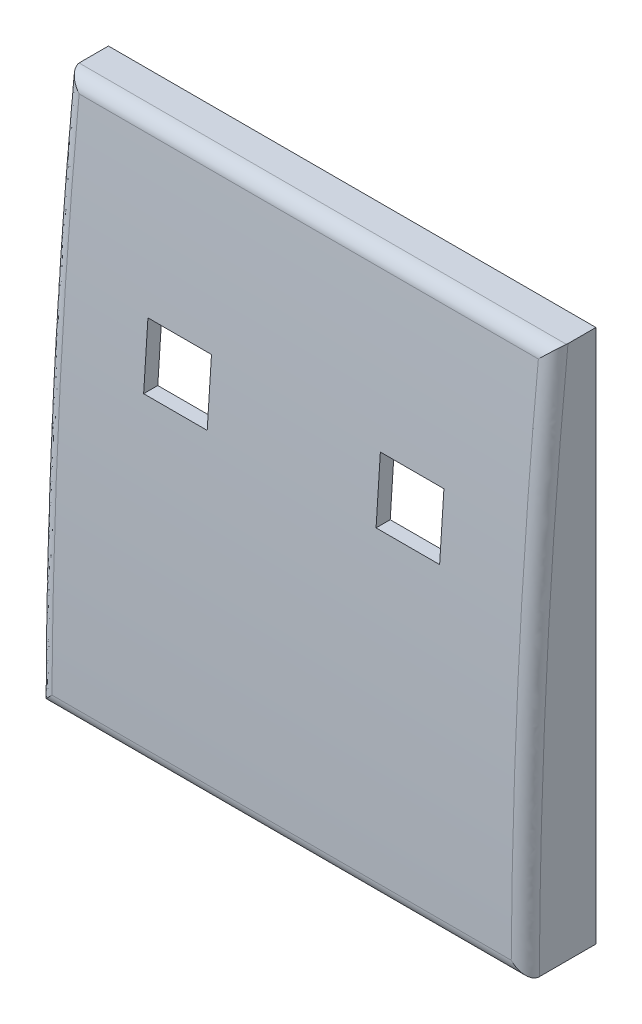
from build123d import *

# Parameters (mm, degrees)
SKETCH_1_W          = 69.038205547
SKETCH_1_H          = 75.629640719
EXTRUDE_1_DEPTH     = 10
CUT_EXTRUDE_1_DEPTH = 103.8888545
FILLET_1_R          = 2
SHELL_START         = 2
SHELL_1_DEPTH       = 65.038205547
SKETCH_3_W          = 9
SKETCH_3_H          = 9
CUT_EXTRUDE_2_DEPTH = 103.887957646


# Read off the part's stored shape, not the designer's step: 쉘1
with BuildPart() as part:
    # 스케치1 → 보스-돌출1 (new body)
    with BuildSketch(Plane.XY):
        with Locations((34.519102774, 37.81482036)):
            Rectangle(SKETCH_1_W, SKETCH_1_H)
    extrude(amount=EXTRUDE_1_DEPTH)

    # 스케치2 → 컷-돌출1 (cut, through all)
    with BuildSketch(Plane(origin=(69.038205547, 0, 0), x_dir=(0, 0, -1), z_dir=(1, 0, 0))):
        with BuildLine():
            Line((-10, 75.629640719), (-10, 0))
            add(Edge.make_bspline(
                [(-5.96238454, 75.629640719), (-9.875617916, 37.91260995), (-10, 0)],
                knots=[0, 0, 0, 1, 1, 1], degree=2))
            Line((-5.96238454, 75.629640719), (-10, 75.629640719))
        make_face()
    extrude(amount=-CUT_EXTRUDE_1_DEPTH, mode=Mode.SUBTRACT)

    # 필렛1
    fillet_1_edges = [part.edges().sort_by_distance(p)[0] for p in [
        (69.038205547, 37.865383105, 8.928316045),
        (34.519102774, 75.629640719, 5.96238454),
        (0, 37.865383105, 8.928316045),
        (34.519102774, 0, 10),
    ]]
    fillet(fillet_1_edges, radius=FILLET_1_R)

    # 쉘1 outline → 쉘1 (cut)
    with BuildSketch(Plane.YZ.offset(SHELL_START)):
        with BuildLine():
            Line((73.629640719, 0), (73.62964072, 4.156994713))
            add(Edge.make_bspline(
                [(73.62964072, 4.156994713), (55.766087317, 5.967380338), (37.873438197, 7.209785835), (19.951481081, 7.884254009), (1.999999998, 7.9907666)],
                knots=[0.023838454, 0.023838454, 0.023838454, 0.023838454, 0.023838454, 0.973465237, 0.973465237, 0.973465237, 0.973465237, 0.973465237], degree=4))
            Line((1.999999998, 7.9907666), (2, 0))
            Line((2, 0), (73.629640719, 0))
        make_face()
    extrude(amount=SHELL_1_DEPTH, mode=Mode.SUBTRACT)

    # 스케치3 → 컷-돌출2 (cut, through all)
    with BuildSketch(Plane.XY):
        with Locations((18.060506117, 48.552575582)):
            Rectangle(SKETCH_3_W, SKETCH_3_H)
        with Locations((50.97769943, 48.552575582)):
            Rectangle(SKETCH_3_W, SKETCH_3_H)
    extrude(amount=CUT_EXTRUDE_2_DEPTH, mode=Mode.SUBTRACT)


solid = part.part
